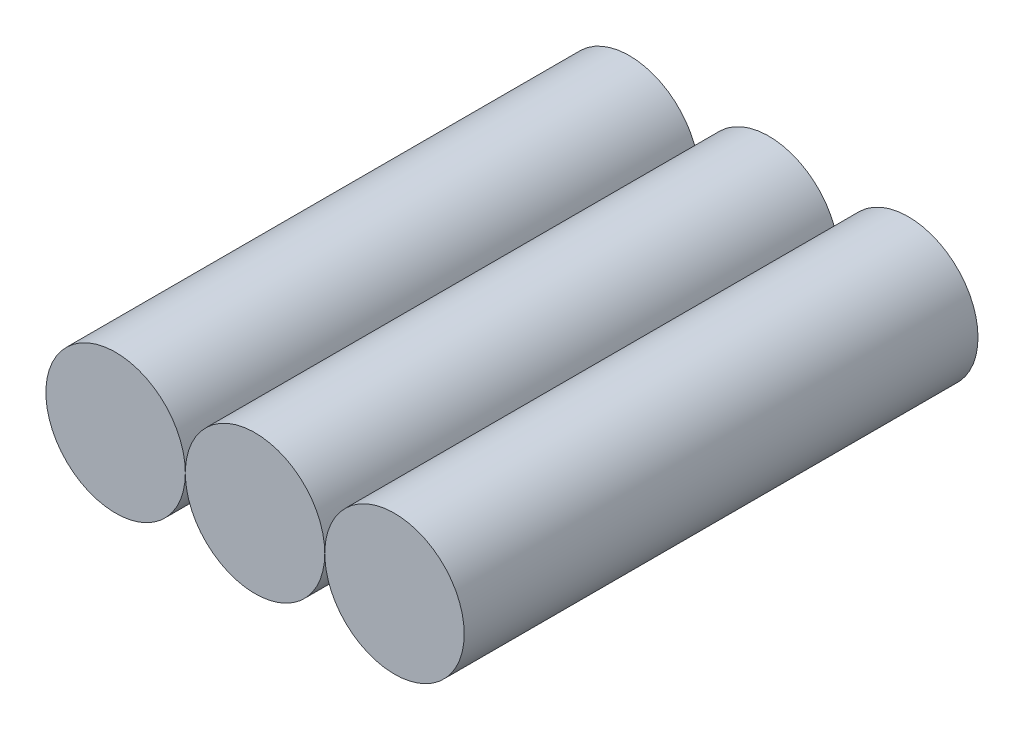
from build123d import *

# Parameters (mm, degrees)
BOSS_EXTRUDE1_DEPTH        = 35
BOSS_EXTRUDE1_DEPTH_BACK   = 35
BOSS_EXTRUDE1_2_DEPTH      = 35
BOSS_EXTRUDE1_2_DEPTH_BACK = 35
SKETCH1_R                  = 9.5
BOSS_EXTRUDE1_3_DEPTH      = 35
BOSS_EXTRUDE1_3_DEPTH_BACK = 35


with BuildPart() as part:
    # Sketch1 → Boss-Extrude1 (new, two sides: drawn at the far end of the back side and taken through both)
    with BuildSketch(Plane.XY.offset(-BOSS_EXTRUDE1_DEPTH_BACK)):
        with BuildLine():
            ThreePointArc((-9.5, 0), (0, -9.5), (9.5, 0))
            ThreePointArc((9.5, 0), (0, 9.5), (-9.5, 0))
        make_face()
    extrude(amount=BOSS_EXTRUDE1_DEPTH + BOSS_EXTRUDE1_DEPTH_BACK)


with BuildPart() as body_2:
    # Sketch1 → Boss-Extrude1 2 (new, two sides: drawn at the far end of the back side and taken through both)
    with BuildSketch(Plane.XY.offset(-BOSS_EXTRUDE1_2_DEPTH_BACK)):
        with Locations((-19, 0)):
            Circle(SKETCH1_R)
    extrude(amount=BOSS_EXTRUDE1_2_DEPTH + BOSS_EXTRUDE1_2_DEPTH_BACK)


with BuildPart() as body_3:
    # Sketch1 → Boss-Extrude1 3 (new, two sides: drawn at the far end of the back side and taken through both)
    with BuildSketch(Plane.XY.offset(-BOSS_EXTRUDE1_3_DEPTH_BACK)):
        with Locations((19, 0)):
            Circle(SKETCH1_R)
    extrude(amount=BOSS_EXTRUDE1_3_DEPTH + BOSS_EXTRUDE1_3_DEPTH_BACK)


solid = Compound([part.part, body_2.part, body_3.part])
